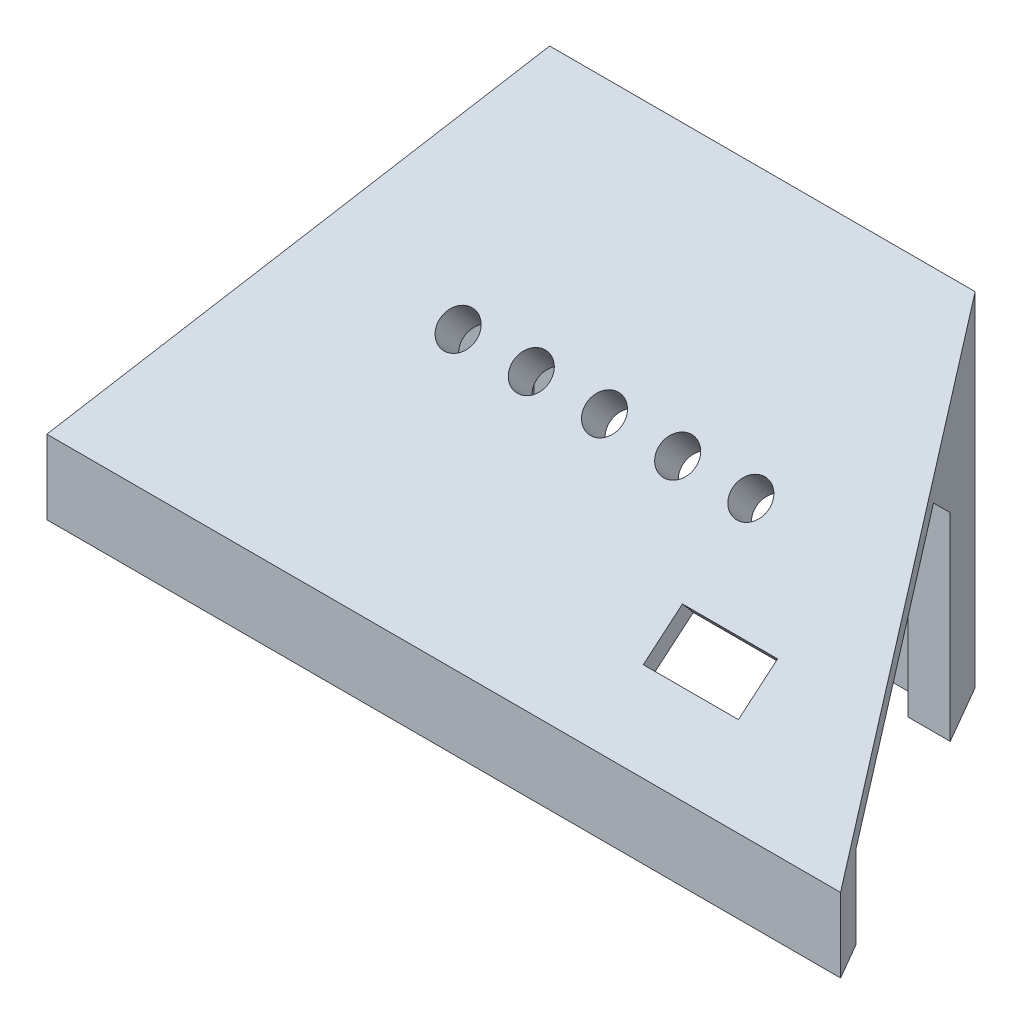
from build123d import *
from OCP.BRepFilletAPI import BRepFilletAPI_MakeChamfer

# Parameters (mm, degrees)
BOSS_EXTRUDE1_DEPTH = 10.13
BOSS_EXTRUDE2_DEPTH = 36.74
CHAMFER1_SIZE2      = 43.55
CHAMFER1_SIZE       = 36.74
CUT_EXTRUDE1_DEPTH  = 50
BOSS_EXTRUDE3_DEPTH = 3
SKETCH12_W          = 43.74
SKETCH12_H          = 39.651859931
CUT_EXTRUDE2_DEPTH  = 5
CUT_EXTRUDE3_REACH  = 127.686
SKETCH13_R          = 2.5
SKETCH15_R          = 3.5
SKETCH15_R_2        = 2.5
BOSS_EXTRUDE4_DEPTH = 5
CUT_EXTRUDE4_REACH  = 127.686
SKETCH16_W          = 13
SKETCH16_H          = 7
LPATTERN1_COUNT     = 5
LPATTERN1_PITCH     = 10
LPATTERN2_COUNT     = 5
LPATTERN2_PITCH     = 10
CUT_EXTRUDE5_REACH  = 167.082
CHAMFER2_SIZE       = 10
CHAMFER2_SIZE2      = 7.096456913
CHAMFER3_SIZE       = 10


with BuildPart() as part:
    # Sketch1 → Boss-Extrude1 (new body)
    with BuildSketch(Plane(origin=(0, 0, 0), x_dir=(1, 0, 0), z_dir=(0, 1, 0))):
        Polygon((0, 0), (108.46, 0), (83.3, 43.55), (25.16, 43.55), align=None)
    extrude(amount=BOSS_EXTRUDE1_DEPTH)

    # Sketch4 → Boss-Extrude2 (add)
    with BuildSketch(Plane(origin=(0, 10.13, 0), x_dir=(1, 0, 0), z_dir=(0, 1, 0))):
        Polygon((25.16, 43.55), (0, 0), (108.46, 0), (83.3, 43.55), align=None)
    extrude(amount=BOSS_EXTRUDE2_DEPTH)

    # Chamfer1
    chamfer1_edges = [part.edges().sort_by_distance(p)[0] for p in [
        (54.23, 46.87, 0),
    ]]
    chamfer1_side = [part.faces().sort_by_distance(p)[0] for p in [
        (54.23, 46.1352, 0),
    ]]
    chamfer(chamfer1_edges, length=CHAMFER1_SIZE - 0.0001, length2=CHAMFER1_SIZE2 - 0.0001, reference=chamfer1_side[0])  # a hair under: the kernel refuses the full size

    # Sketch10 → Cut-Extrude1 (cut)
    with BuildSketch(Plane.XZ):
        Polygon((8.66307788, -5), (28.045810372, -38.55), (80.414189628, -38.55), (99.79692212, -5), align=None)
    extrude(amount=-CUT_EXTRUDE1_DEPTH, mode=Mode.SUBTRACT)

    # Sketch11 → Boss-Extrude3 (add, along a direction that is not the sketch's normal)
    with BuildSketch(Plane(origin=(0, 5.918064684, 4.992645155), x_dir=(1, 0, 0), z_dir=(0, 0.7643374360351171, 0.6448164730179148))):
        Polygon((8.66307788, 13.073604254), (99.79692212, 13.073604254), (80.414189628, 56.967830048), (28.045810372, 56.967830048), align=None)
    extrude(amount=-BOSS_EXTRUDE3_DEPTH, dir=(0, 1, 0))

    # Sketch12 → Cut-Extrude2 (cut)
    with BuildSketch(Plane(origin=(0, 0, -43.55), x_dir=(-1, 0, 0), z_dir=(0, 0, -1))):
        with Locations((-54.23, 19.825929966)):
            Rectangle(SKETCH12_W, SKETCH12_H)
    extrude(amount=-CUT_EXTRUDE2_DEPTH, mode=Mode.SUBTRACT)

    # Sketch13 → Cut-Extrude3 (cut, up to next)
    with BuildSketch(Plane(origin=(0, 5.918064684, 4.992645155), x_dir=(1, 0, 0), z_dir=(0, 0.7643374360351171, 0.6448164730179148)), mode=Mode.PRIVATE) as cut_extrude3_sk1:
        with Locations(Location((74.23, 35.27486423, 0), (0, 0, 270))):
            Circle(SKETCH13_R)
    cut_extrude3_tool1 = extrude(cut_extrude3_sk1.sketch, amount=-CUT_EXTRUDE3_REACH, mode=Mode.PRIVATE) & part.part
    cut_extrude3 = cut_extrude3_tool1.solids().sort_by_distance((74.23, 28.663878, -21.969254))[0]
    add(cut_extrude3, mode=Mode.SUBTRACT)

    # Sketch15 → Boss-Extrude4 (add)
    with BuildSketch(Plane(origin=(0, 5.918064684, 4.992645155), x_dir=(1, 0, 0), z_dir=(0, 0.7643374360351171, 0.6448164730179148))):
        with Locations(Location((74.23, 35.27486423, 0), (0, 0, 270))):
            Circle(SKETCH15_R)
        with Locations(Location((74.23, 35.27486423, 0), (0, 0, 270))):
            Circle(SKETCH15_R_2, mode=Mode.SUBTRACT)
    boss_extrude4 = extrude(amount=-BOSS_EXTRUDE4_DEPTH)

    # Sketch16 → Cut-Extrude4 (cut, up to next)
    with BuildSketch(Plane(origin=(0, 5.918064684, 4.992645155), x_dir=(1, 0, 0), z_dir=(0, 0.7643374360351172, 0.6448164730179149)), mode=Mode.PRIVATE) as cut_extrude4_sk1:
        with Locations((80.69536615, 19.590719272)):
            Rectangle(SKETCH16_W, SKETCH16_H)
    cut_extrude4_tool1 = extrude(cut_extrude4_sk1.sketch, amount=-CUT_EXTRUDE4_REACH, mode=Mode.PRIVATE) & part.part
    add(cut_extrude4_tool1.solids().sort_by_distance((80.695366, 18.550483, -9.981275))[0], mode=Mode.SUBTRACT)

    # LPattern1: Cut-Extrude3 ×5
    with Locations(*[(-i * LPATTERN1_PITCH, 0, 0) for i in range(1, LPATTERN1_COUNT)]):
        add(cut_extrude3, mode=Mode.SUBTRACT)

    # LPattern2: Boss-Extrude4 ×5
    with Locations(*[(-i * LPATTERN2_PITCH, 0, 0) for i in range(1, LPATTERN2_COUNT)]):
        add(boss_extrude4)

    # Cut-Extrude5: up to this plane
    cut_extrude5_end = Plane(origin=(0, 0, 0), z_dir=(0, -1, 0))
    # Sketch20 → Cut-Extrude5 (cut, up to the surface)
    with BuildSketch(Plane(origin=(0, 4.165429536, 3.514073046), x_dir=(1, 0, 0), z_dir=(0, -0.7643374360351171, -0.644816473017915)), mode=Mode.PRIVATE) as cut_extrude5_sk1:
        Polygon((10.517235303, -11.139154835), (2.034423094, -11.139154835), (19.650842851, -51.033380629), (29.759813719, -51.033380629), align=None)
    cut_extrude5_tool1 = split(extrude(cut_extrude5_sk1.sketch, amount=CUT_EXTRUDE5_REACH, dir=(0, -1, 0), mode=Mode.PRIVATE), bisect_by=cut_extrude5_end, keep=Keep.BOTH, mode=Mode.PRIVATE)
    add(cut_extrude5_tool1.solids().sort_by_distance((15.759239, 24.585372, -20.690839))[0], mode=Mode.SUBTRACT)
    # Sketch20 → Cut-Extrude5 (cut, up to the surface)
    with BuildSketch(Plane(origin=(0, 4.165429536, 3.514073046), x_dir=(1, 0, 0), z_dir=(0, -0.7643374360351171, -0.644816473017915)), mode=Mode.PRIVATE) as cut_extrude5_sk2:
        Polygon((78.700186281, -51.033380629), (97.942764697, -11.139154835), (106.425576906, -11.139154835), (88.809157149, -51.033380629), align=None)
    cut_extrude5_tool2 = split(extrude(cut_extrude5_sk2.sketch, amount=CUT_EXTRUDE5_REACH, dir=(0, -1, 0), mode=Mode.PRIVATE), bisect_by=cut_extrude5_end, keep=Keep.BOTH, mode=Mode.PRIVATE)
    add(cut_extrude5_tool2.solids().sort_by_distance((92.700761, 24.585372, -20.690839))[0], mode=Mode.SUBTRACT)

    # Chamfer2: one chamfer whose edges measure the first distance from different faces: ONE call of the kernel's chamfer builder (chamfer() names one face for all edges)
    chamfer2_edges_1 = [part.edges().sort_by_distance(p)[0] for p in [
        (23.392275575, 37.072594039, -35.492650256),
    ]]
    chamfer2_side_1 = [part.faces().sort_by_distance(p)[0] for p in [
        (23.392275575, 18.53629702, -35.492650256),
    ]]
    chamfer2_edges_2 = [part.edges().sort_by_distance(p)[0] for p in [
        (85.067724425, 37.072594039, -35.492650256),
    ]]
    chamfer2_side_2 = [part.faces().sort_by_distance(p)[0] for p in [
        (85.067724425, 18.53629702, -35.492650256),
    ]]
    chamfer2 = BRepFilletAPI_MakeChamfer(part.part.solid().wrapped)
    for e in chamfer2_edges_1:
        chamfer2.Add(CHAMFER2_SIZE, CHAMFER2_SIZE2, e.wrapped, chamfer2_side_1[0].wrapped)  # the first distance lies on this face
    for e in chamfer2_edges_2:
        chamfer2.Add(CHAMFER2_SIZE, CHAMFER2_SIZE2, e.wrapped, chamfer2_side_2[0].wrapped)  # the first distance lies on this face
    add(Compound.cast(chamfer2.Shape()), mode=Mode.REPLACE)

    # Chamfer3
    chamfer3_edges = [part.edges().sort_by_distance(p)[0] for p in [
        (32.36, 39.651859931, -41.05),
        (76.1, 39.651859931, -41.05),
    ]]
    chamfer(chamfer3_edges, length=CHAMFER3_SIZE)


solid = part.part
